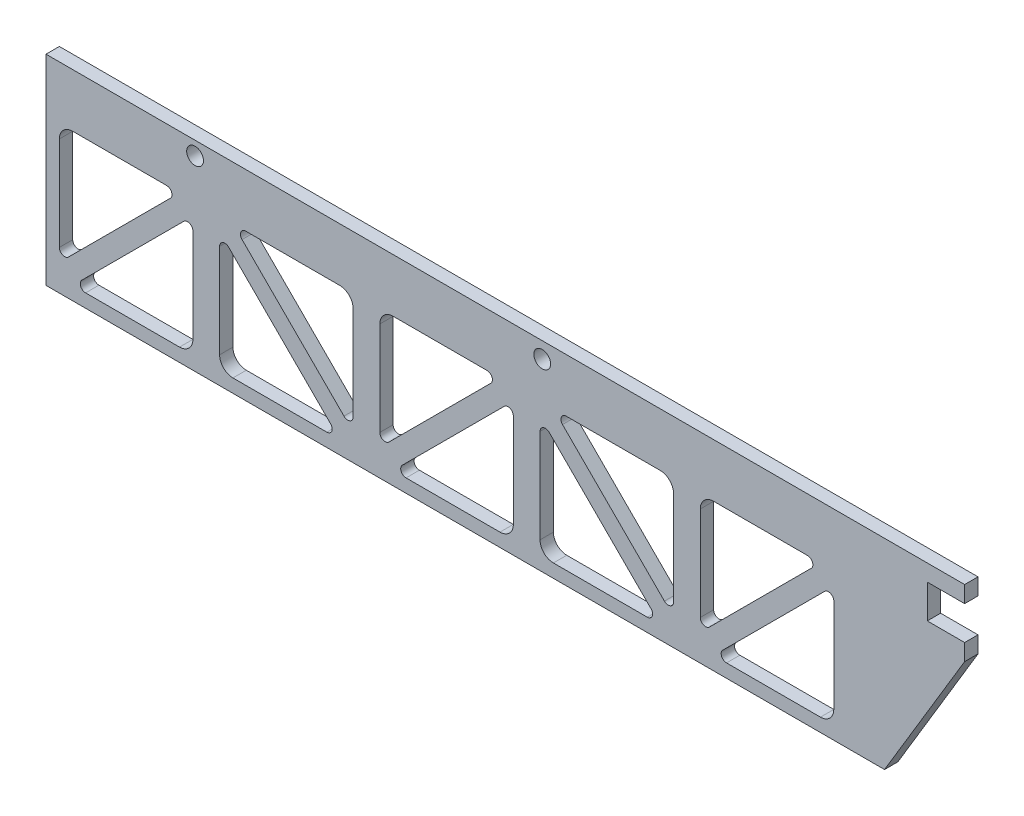
from build123d import *

# Parameters (mm, degrees)
MODEL_R             = 4
BOSS_EXTRUDE2_DEPTH = 6.35


with BuildPart() as part:
    # Model → Boss-Extrude2 (new body)
    with BuildSketch(Plane.XY):
        Polygon((419.1, 87.376), (419.1, 71.374), (436.88, 71.374), (436.88, 63.5), (398.78, 0), (0, 0), (0, 95.25), (436.88, 95.25), (436.88, 87.376), align=None)
        with Locations((70.891700524, 88.801347744)):
            Circle(MODEL_R, mode=Mode.SUBTRACT)
        with Locations((235.991700524, 87.63)):
            Circle(MODEL_R, mode=Mode.SUBTRACT)
        with BuildLine():
            Line((171.232102448, 6.35), (215.9, 6.35))
            ThreePointArc((215.9, 6.35), (220.390128061, 8.209871939), (222.25, 12.7))
            Line((222.25, 12.7), (222.25, 57.367897552))
            ThreePointArc((222.25, 57.367897552), (220.682015918, 59.714551565), (217.913948776, 59.163948776))
            Line((217.913948776, 59.163948776), (169.436051224, 10.686051224))
            ThreePointArc((169.436051224, 10.686051224), (168.885448435, 7.917984082), (171.232102448, 6.35))
        make_face(mode=Mode.SUBTRACT)
        with BuildLine():
            Line((234.95, 57.367897552), (234.95, 12.7))
            ThreePointArc((234.95, 12.7), (236.809871939, 8.209871939), (241.3, 6.35))
            Line((241.3, 6.35), (285.967897552, 6.35))
            ThreePointArc((285.967897552, 6.35), (288.314551565, 7.917984082), (287.763948776, 10.686051224))
            Line((287.763948776, 10.686051224), (239.286051224, 59.163948776))
            ThreePointArc((239.286051224, 59.163948776), (236.517984082, 59.714551565), (234.95, 57.367897552))
        make_face(mode=Mode.SUBTRACT)
        with BuildLine():
            Line((294.113948776, 17.036051224), (245.636051224, 65.513948776))
            ThreePointArc((245.636051224, 65.513948776), (245.085448435, 68.282015918), (247.432102448, 69.85))
            Line((247.432102448, 69.85), (292.1, 69.85))
            ThreePointArc((292.1, 69.85), (296.590128061, 67.990128061), (298.45, 63.5))
            Line((298.45, 63.5), (298.45, 18.832102448))
            ThreePointArc((298.45, 18.832102448), (296.882015918, 16.485448435), (294.113948776, 17.036051224))
        make_face(mode=Mode.SUBTRACT)
        with BuildLine():
            Line((323.632102448, 6.35), (368.3, 6.35))
            ThreePointArc((368.3, 6.35), (372.790128061, 8.209871939), (374.65, 12.7))
            Line((374.65, 12.7), (374.65, 57.367897552))
            ThreePointArc((374.65, 57.367897552), (373.082015918, 59.714551565), (370.313948776, 59.163948776))
            Line((370.313948776, 59.163948776), (321.836051224, 10.686051224))
            ThreePointArc((321.836051224, 10.686051224), (321.285448435, 7.917984082), (323.632102448, 6.35))
        make_face(mode=Mode.SUBTRACT)
        with BuildLine():
            Line((18.832102448, 6.35), (63.5, 6.35))
            ThreePointArc((63.5, 6.35), (67.990128061, 8.209871939), (69.85, 12.7))
            Line((69.85, 12.7), (69.85, 57.367897552))
            ThreePointArc((69.85, 57.367897552), (68.282015918, 59.714551565), (65.513948776, 59.163948776))
            Line((65.513948776, 59.163948776), (17.036051224, 10.686051224))
            ThreePointArc((17.036051224, 10.686051224), (16.485448435, 7.917984082), (18.832102448, 6.35))
        make_face(mode=Mode.SUBTRACT)
        with BuildLine():
            Line((82.55, 57.367897552), (82.55, 12.7))
            ThreePointArc((82.55, 12.7), (84.409871939, 8.209871939), (88.9, 6.35))
            Line((88.9, 6.35), (133.567897552, 6.35))
            ThreePointArc((133.567897552, 6.35), (135.914551565, 7.917984082), (135.363948776, 10.686051224))
            Line((135.363948776, 10.686051224), (86.886051224, 59.163948776))
            ThreePointArc((86.886051224, 59.163948776), (84.117984082, 59.714551565), (82.55, 57.367897552))
        make_face(mode=Mode.SUBTRACT)
        with BuildLine():
            Line((93.236051224, 65.513948776), (141.713948776, 17.036051224))
            ThreePointArc((141.713948776, 17.036051224), (144.482015918, 16.485448435), (146.05, 18.832102448))
            Line((146.05, 18.832102448), (146.05, 63.5))
            ThreePointArc((146.05, 63.5), (144.190128061, 67.990128061), (139.7, 69.85))
            Line((139.7, 69.85), (95.032102448, 69.85))
            ThreePointArc((95.032102448, 69.85), (92.685448435, 68.282015918), (93.236051224, 65.513948776))
        make_face(mode=Mode.SUBTRACT)
        with BuildLine():
            Line((163.086051224, 17.036051224), (211.563948776, 65.513948776))
            ThreePointArc((211.563948776, 65.513948776), (212.114551565, 68.282015918), (209.767897552, 69.85))
            Line((209.767897552, 69.85), (165.1, 69.85))
            ThreePointArc((165.1, 69.85), (160.609871939, 67.990128061), (158.75, 63.5))
            Line((158.75, 63.5), (158.75, 18.832102448))
            ThreePointArc((158.75, 18.832102448), (160.317984082, 16.485448435), (163.086051224, 17.036051224))
        make_face(mode=Mode.SUBTRACT)
        with BuildLine():
            Line((315.486051224, 17.036051224), (363.963948776, 65.513948776))
            ThreePointArc((363.963948776, 65.513948776), (364.514551565, 68.282015918), (362.167897552, 69.85))
            Line((362.167897552, 69.85), (317.5, 69.85))
            ThreePointArc((317.5, 69.85), (313.009871939, 67.990128061), (311.15, 63.5))
            Line((311.15, 63.5), (311.15, 18.832102448))
            ThreePointArc((311.15, 18.832102448), (312.717984082, 16.485448435), (315.486051224, 17.036051224))
        make_face(mode=Mode.SUBTRACT)
        with BuildLine():
            Line((6.35, 63.5), (6.35, 18.832102448))
            ThreePointArc((6.35, 18.832102448), (7.917984082, 16.485448435), (10.686051224, 17.036051224))
            Line((10.686051224, 17.036051224), (59.163948776, 65.513948776))
            ThreePointArc((59.163948776, 65.513948776), (59.714551565, 68.282015918), (57.367897552, 69.85))
            Line((57.367897552, 69.85), (12.7, 69.85))
            ThreePointArc((12.7, 69.85), (8.209871939, 67.990128061), (6.35, 63.5))
        make_face(mode=Mode.SUBTRACT)
    extrude(amount=BOSS_EXTRUDE2_DEPTH)


solid = part.part
